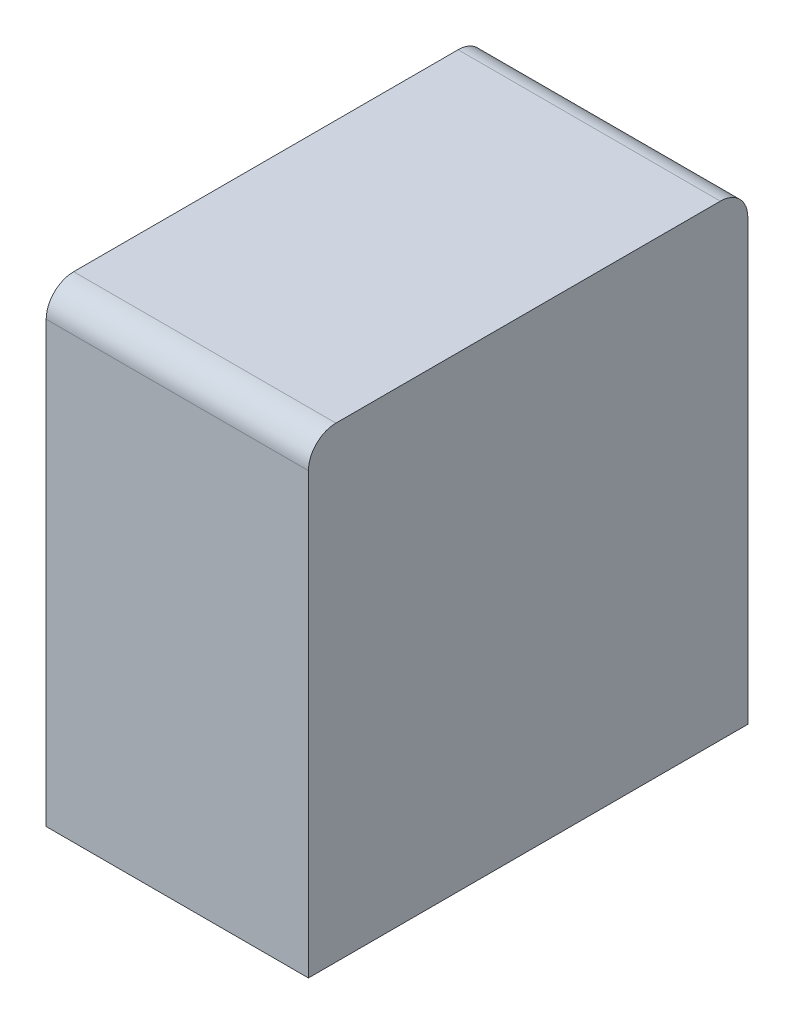
from build123d import *

# Parameters (mm, degrees)
SKETCH_1_W      = 9.55
SKETCH_1_H      = 16
EXTRUDE_1_DEPTH = 17
SKETCH_2_R      = 0.6
EXTRUDE_2_DEPTH = 4
FILLET_1_R      = 1


with BuildPart() as part:
    # 草图1 → 拉伸1 (new body)
    with BuildSketch(Plane(origin=(0, 0, 0), x_dir=(1, 0, 0), z_dir=(0, 1, 0))):
        Rectangle(SKETCH_1_W, SKETCH_1_H)
    extrude(amount=EXTRUDE_1_DEPTH)

    # 草图2 → 拉伸2 (add)
    with BuildSketch(Plane.XZ):
        with Locations((-2, 0)):
            Circle(SKETCH_2_R)
    extrude(amount=EXTRUDE_2_DEPTH)

    # 圆角1
    fillet_1_edges = [part.edges().sort_by_distance(p)[0] for p in [
        (0, 17, 8),
        (0, 17, -8),
    ]]
    fillet(fillet_1_edges, radius=FILLET_1_R)


solid = part.part
